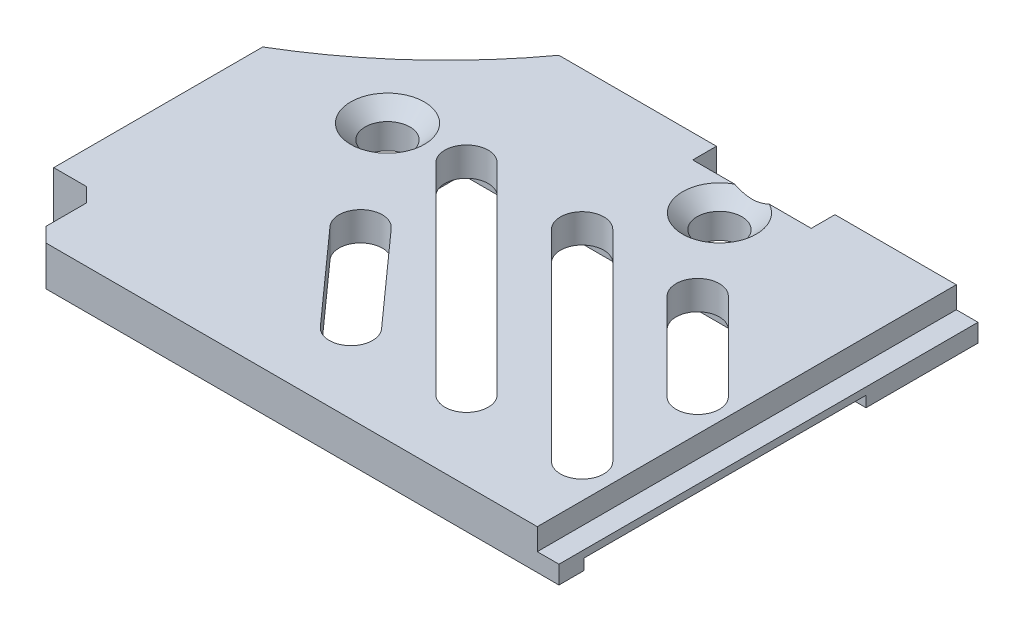
from build123d import *

# Parameters (mm, degrees)
SKETCH_221_R           = 1.55
EXTRUDE_926_DEPTH      = 2.75
SKETCH_1005_W          = 35.000000002
SKETCH_1005_H          = 4.75
EXTRUDE_1111_DEPTH     = 2.75
EXTRUDE_1_DEPTH        = 2.75
F_2_PCB_START          = -4
F_2_PCB_DEPTH          = 4
SKETCH_2154_W          = 1.5
SKETCH_2154_H          = 28.99988509
EXTRUDE_2226_DEPTH     = 1.25
SKETCH_2278_W          = 27.915979255
SKETCH_2278_H          = 19.5
PCB_DEPTH              = 0.75
CUT_EXTRUDE_2_DEPTH    = 33.451352798
CHAMFER_1_SIZE         = 1
CHAMFER_2_SIZE         = 1
CUT_EXTRUDE_3375_DEPTH = 4


with BuildPart() as part:
    # Sketch 221 → Extrude 926 (new body)
    with BuildSketch(Plane(origin=(0, 0, 0), x_dir=(1, 0, 0), z_dir=(0, 1, 0))):
        with BuildLine():
            ThreePointArc((-16.252981126, 10), (-20.15501929, 5.688743466), (-24.715186194, 2.08073674))
            Line((-24.715186194, 2.08073674), (-24.500000002, 0.312480077))
            Line((-24.500000002, 0.312480077), (-24.500000002, -7.263629174))
            Line((-24.500000002, -7.263629174), (-22.500000002, -7.263629174))
            Line((-22.500000002, -7.263629174), (-22.500000002, -14.24988509))
            Line((-22.500000002, -14.24988509), (12.5, -14.24988509))
            Line((12.5, -14.24988509), (12.5, 10))
            Line((12.5, 10), (4.100927374, 10))
            Line((4.100927374, 10), (4.100927374, 8.35804307))
            Line((4.100927374, 8.35804307), (-4.100927378, 8.35804307))
            Line((-4.100927378, 8.35804307), (-4.100927378, 10))
            Line((-4.100927378, 10), (-16.252981126, 10))
        make_face()
        with Locations(Location((-16.865979255, 0, 0), (0, 0, 270))):
            Circle(SKETCH_221_R, mode=Mode.SUBTRACT)
        with Locations(Location((-2e-09, 6.108043073, 0), (0, 0, 270))):
            Circle(SKETCH_221_R, mode=Mode.SUBTRACT)
    extrude(amount=EXTRUDE_926_DEPTH)

    # Sketch 1005 → Extrude 1111 (add)
    with BuildSketch(Plane(origin=(0, 0, 0), x_dir=(1, 0, 0), z_dir=(0, 1, 0))):
        with Locations((-5.000000001, -16.62488509)):
            Rectangle(SKETCH_1005_W, SKETCH_1005_H)
    extrude(amount=EXTRUDE_1111_DEPTH)

    # Sketch 1191 → 卡榫结构-1 (add)
    with BuildSketch(Plane(origin=(0, 0, 0), x_dir=(1, 0, 0), z_dir=(0, 1, 0))):
        with BuildLine():
            Line((-25.750000002, -14.213629174), (-22.500000002, -14.213629174))
            Line((-22.500000002, -14.213629174), (-22.500000002, -7.263629174))
            Line((-22.500000002, -7.263629174), (-24.500000002, -7.263629174))
            Line((-24.500000002, -7.263629174), (-24.500000002, 0.312480077))
            Line((-24.500000002, 0.312480077), (-24.715186194, 2.08073674))
            ThreePointArc((-24.715186194, 2.08073674), (-25.291636518, 1.705823535), (-25.875319612, 1.342273079))
            Line((-25.875319612, 1.342273079), (-25.750000002, 0.312480077))
            Line((-25.750000002, 0.312480077), (-25.750000002, -14.213629174))
        make_face()
    extrude(amount=EXTRUDE_1_DEPTH)

    # 草图5<4> → 卡榫结构-2-注意PCB凸出部分 (add)
    with BuildSketch(Plane(origin=(0, 0, 0), x_dir=(1, 0, 0), z_dir=(0, 1, 0)).offset(F_2_PCB_START)):
        with BuildLine():
            Line((-25.750000002, -14.213629174), (-23.500000002, -14.213629174))
            Line((-23.500000002, -14.213629174), (-23.500000002, -7.263629174))
            Line((-23.500000002, -7.263629174), (-24.500000002, -7.263629174))
            Line((-24.500000002, -7.263629174), (-24.500000002, 0.312480077))
            Line((-24.500000002, 0.312480077), (-24.715186194, 2.08073674))
            ThreePointArc((-24.715186194, 2.08073674), (-25.291636518, 1.705823535), (-25.875319612, 1.342273079))
            Line((-25.875319612, 1.342273079), (-25.750000002, 0.312480077))
            Line((-25.750000002, 0.312480077), (-25.750000002, -14.213629174))
        make_face()
    extrude(amount=F_2_PCB_DEPTH)

    # Sketch 2154 → Extrude 2226 (add)
    with BuildSketch(Plane(origin=(0, 0, 0), x_dir=(1, 0, 0), z_dir=(0, 1, 0))):
        with Locations((13.25, -4.499942545)):
            Rectangle(SKETCH_2154_W, SKETCH_2154_H)
    extrude(amount=EXTRUDE_2226_DEPTH)

    # Sketch 2278 → 稳压PCB器件高度补偿 (cut)
    with BuildSketch(Plane(origin=(0, 0, 0), x_dir=(1, 0, 0), z_dir=(0, 1, 0))):
        with Locations((0.042010372, -7.5)):
            Rectangle(SKETCH_2278_W, SKETCH_2278_H)
    extrude(amount=PCB_DEPTH, mode=Mode.SUBTRACT)

    # Sketch 2514 → 切除-拉伸2 (cut, through all)
    with BuildSketch(Plane.XZ.offset(-0.75)):
        with BuildLine():
            Line((3.173198201, 0.69066828), (9.20694903, 6.724419109))
            ThreePointArc((9.20694903, 6.724419109), (11.328269373, 6.724419109), (11.328269373, 4.603098766))
            Line((11.328269373, 4.603098766), (5.294518544, -1.430652063))
            ThreePointArc((5.294518544, -1.430652063), (3.173198201, -1.430652063), (3.173198201, 0.69066828))
        make_face()
        with BuildLine():
            Line((-4.826801799, 0.69066828), (9.08250112, 14.5999712))
            ThreePointArc((9.08250112, 14.5999712), (11.203821464, 14.5999712), (11.203821464, 12.478650856))
            Line((11.203821464, 12.478650856), (-2.705481456, -1.430652063))
            ThreePointArc((-2.705481456, -1.430652063), (-4.826801799, -1.430652063), (-4.826801799, 0.69066828))
        make_face()
        with BuildLine():
            Line((-12.826801799, 0.69066828), (1.08250112, 14.5999712))
            ThreePointArc((1.08250112, 14.5999712), (3.203821464, 14.5999712), (3.203821464, 12.478650856))
            Line((3.203821464, 12.478650856), (-10.705481456, -1.430652063))
            ThreePointArc((-10.705481456, -1.430652063), (-12.826801799, -1.430652063), (-12.826801799, 0.69066828))
        make_face()
        with BuildLine():
            Line((-4.738916917, 12.539185601), (-10.437516852, 6.169395501))
            ThreePointArc((-10.437516852, 6.169395501), (-12.555564069, 6.051599138), (-12.673360433, 8.169646355))
            Line((-12.673360433, 8.169646355), (-6.974760498, 14.539436455))
            ThreePointArc((-6.974760498, 14.539436455), (-4.856713281, 14.657232819), (-4.738916917, 12.539185601))
        make_face()
    extrude(amount=-CUT_EXTRUDE_2_DEPTH, mode=Mode.SUBTRACT)

    # 倒角1
    chamfer_1_edges = [part.edges().sort_by_distance(p)[0] for p in [
        (-20.661675073, 2.75, -5.223818951),
        (-22.500000002, 1.375, 18.99988509),
        (-22.500000002, 1.375, 14.213629174),
    ]]
    chamfer(chamfer_1_edges, length=CHAMFER_1_SIZE)

    # 倒角2
    # the kernel refuses this chamfer: 1 mm, written as the material it takes off along each edge
    with BuildSketch(Plane(origin=(-2e-09, 2.75, -6.108043073), x_dir=(0, 0, 1), z_dir=(-1, 0, 0))) as chamfer_2_piece_1:
        Polygon((1.55 + CHAMFER_2_SIZE, 0), (1.55, -CHAMFER_2_SIZE), (1.55, 0), align=None)
    revolve(axis=Axis((-2e-09, 2.75, -6.108043073), (0, 1, 0)), mode=Mode.SUBTRACT)
    with BuildSketch(Plane(origin=(-16.865979255, 2.75, 0), x_dir=(0, 0, 1), z_dir=(-1, 0, 0))) as chamfer_2_piece_2:
        Polygon((1.55 + CHAMFER_2_SIZE, 0), (1.55, -CHAMFER_2_SIZE), (1.55, 0), align=None)
    revolve(axis=Axis((-16.865979255, 2.75, 0), (0, 1, 0)), mode=Mode.SUBTRACT)

    # 草图1 → Cut-Extrude 3375 (cut)
    with BuildSketch(Plane.XZ.offset(4)):
        with BuildLine():
            Line((-24.715186194, -2.08073674), (-24.500000002, -0.312480077))
            Line((-24.500000002, -0.312480077), (-24.500000002, 7.263629174))
            Line((-24.500000002, 7.263629174), (-23.500000002, 7.263629174))
            Line((-23.500000002, 7.263629174), (-23.500000002, 7.513629174))
            Line((-23.500000002, 7.513629174), (-24.750000002, 7.513629174))
            Line((-24.750000002, 7.513629174), (-24.750000002, -0.312480077))
            Line((-24.750000002, -0.312480077), (-24.946632534, -1.928275128))
            ThreePointArc((-24.946632534, -1.928275128), (-24.830758909, -2.004277534), (-24.715186194, -2.08073674))
        make_face()
    extrude(amount=-CUT_EXTRUDE_3375_DEPTH, mode=Mode.SUBTRACT)


solid = part.part
